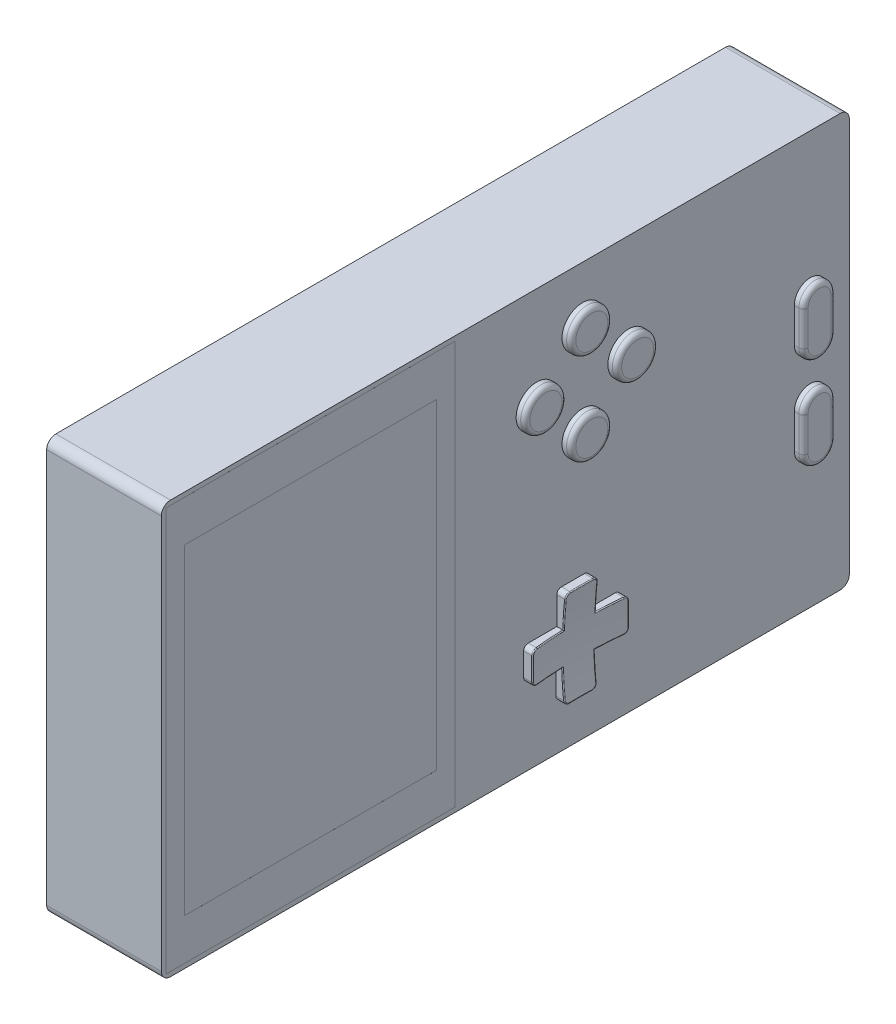
from build123d import *

# Parameters (mm, degrees)
SKETCH1_W           = 90
SKETCH1_H           = 150
SKETCH1_R           = 4.5
BOSS_EXTRUDE1_DEPTH = 25
BOSS_EXTRUDE2_DEPTH = 25.001
SKETCH1_5_W         = 70
SKETCH1_5_H         = 55
BOSS_EXTRUDE3_DEPTH = 25
SKETCH1_6_R         = 4.5
BOSS_EXTRUDE4_DEPTH = 27
BOSS_EXTRUDE5_DEPTH = 27
FILLET1_R           = 1
FILLET2_R           = 1
FILLET4_R           = 2
FILLET7_R           = 0.2


with BuildPart() as part:
    # Sketch1 → Boss-Extrude1 (new body)
    with BuildSketch(Plane.YZ):
        Rectangle(SKETCH1_W, SKETCH1_H)
        with BuildLine():
            ThreePointArc((-13.75, -70), (-17.25, -66.5), (-13.75, -63))
            Line((-13.75, -63), (-6.25, -63))
            ThreePointArc((-6.25, -63), (-2.75, -66.5), (-6.25, -70))
            Line((-6.25, -70), (-13.75, -70))
        make_face(mode=Mode.SUBTRACT)
        Polygon((-35, -11), (-28, -11), (-28, -4), (-21, -4), (-21, -11.236742726), (-14, -11.236742726), (-14, -18.236742726), (-21, -18.236742726), (-21, -25), (-28, -25), (-28, -18), (-35, -18), align=None, mode=Mode.SUBTRACT)
        with BuildLine():
            Line((6.25, -63), (13.75, -63))
            ThreePointArc((13.75, -63), (17.25, -66.5), (13.75, -70))
            Line((13.75, -70), (6.25, -70))
            ThreePointArc((6.25, -70), (2.75, -66.5), (6.25, -63))
        make_face(mode=Mode.SUBTRACT)
        with Locations((22.873097095, -26.851155952)):
            Circle(SKETCH1_R, mode=Mode.SUBTRACT)
        with Locations((32.873097095, -16.851155952)):
            Circle(SKETCH1_R, mode=Mode.SUBTRACT)
        Polygon((44, 11), (0, 11), (-44, 11), (-44, 74), (44, 74), align=None, mode=Mode.SUBTRACT)
    extrude(amount=BOSS_EXTRUDE1_DEPTH)

    # Sketch1<4> → Boss-Extrude2 (add)
    with BuildSketch(Plane.YZ):
        Polygon((-44, 11), (0, 11), (44, 11), (44, 74), (-44, 74), align=None)
        Polygon((-35, 15), (-35, 70), (35, 70), (35, 15), (0, 15), align=None, mode=Mode.SUBTRACT)
    extrude(amount=BOSS_EXTRUDE2_DEPTH)

    # Sketch1<6> → Boss-Extrude4 (add)
    with BuildSketch(Plane.YZ):
        Polygon((-28, -4), (-28, -11), (-35, -11), (-35, -18), (-28, -18), (-28, -25), (-21, -25), (-21, -18.236742726), (-14, -18.236742726), (-14, -11.236742726), (-21, -11.236742726), (-21, -4), align=None)
        with Locations((12.873097095, -16.851155952)):
            Circle(SKETCH1_6_R)
        with Locations((22.873097095, -6.851155952)):
            Circle(SKETCH1_6_R)
        with Locations((22.873097095, -26.851155952)):
            Circle(SKETCH1_6_R)
        with Locations((32.873097095, -16.851155952)):
            Circle(SKETCH1_6_R)
    extrude(amount=BOSS_EXTRUDE4_DEPTH)

    # Sketch1<7> → Boss-Extrude5 (add)
    with BuildSketch(Plane.YZ):
        with BuildLine():
            Line((-6.25, -63), (-13.75, -63))
            ThreePointArc((-13.75, -63), (-17.25, -66.5), (-13.75, -70))
            Line((-13.75, -70), (-6.25, -70))
            ThreePointArc((-6.25, -70), (-2.75, -66.5), (-6.25, -63))
        make_face()
        with BuildLine():
            ThreePointArc((13.75, -70), (17.25, -66.5), (13.75, -63))
            Line((13.75, -63), (6.25, -63))
            ThreePointArc((6.25, -63), (2.75, -66.5), (6.25, -70))
            Line((6.25, -70), (13.75, -70))
        make_face()
    extrude(amount=BOSS_EXTRUDE5_DEPTH)

    # Fillet1
    fillet1_edges = [part.edges().sort_by_distance(p)[0] for p in [
        (27, 18.373097095, -26.851155952),
        (26, -28, -4),
        (26, -35, -11),
        (26, -35, -18),
        (26, -28, -25),
        (26, -21, -25),
        (26, -21, -4),
        (26, -14, -11.236742726),
        (26, -14, -18.236742726),
        (27, 28.373097095, -16.851155952),
        (27, 8.373097095, -16.851155952),
        (27, 18.373097095, -6.851155952),
    ]]
    fillet(fillet1_edges, radius=FILLET1_R)

    # Fillet2
    fillet2_edges = [part.edges().sort_by_distance(p)[0] for p in [
        (27, 17.25, -66.5),
        (27, 10, -63),
        (27, 2.75, -66.5),
        (27, -17.25, -66.5),
        (27, -10, -63),
        (27, -2.75, -66.5),
        (27, 10, -70),
        (27, -10, -70),
    ]]
    fillet(fillet2_edges, radius=FILLET2_R)

    # Fillet4
    fillet4_edges = [part.edges().sort_by_distance(p)[0] for p in [
        (12.5, 45, 75),
        (12.5, -45, 75),
        (12.5, -45, -75),
        (12.5, 45, -75),
    ]]
    fillet(fillet4_edges, radius=FILLET4_R)

    # Sketch4 → Cut-Revolve5 (revolve, cut)
    with BuildSketch(Plane(origin=(0, -24.5, 0), x_dir=(-1, 0, 0), z_dir=(0, 1, 0))):
        with BuildLine():
            Line((-27, -3.5), (-27, -14.5))
            Line((-27, -14.5), (-26.510962298, -14.5))
            Line((-26.510962298, -14.5), (-26.35, -14.5))
            ThreePointArc((-26.35, -14.5), (-26.512641605, -8.990406095), (-27, -3.5))
        make_face()
    revolve(axis=Axis((26.25, -24.5, -14.5), (1, 0, 0)), mode=Mode.SUBTRACT)

    # Fillet7
    fillet7_edges = [part.edges().sort_by_distance(p)[0] for p in [
        (26.633844877, -17.996624049, -11.236742726),
        (26.956859924, -14.293763614, -11.52876663),
        (26.942369977, -14, -14.736828663),
        (26.973231747, -14.293739929, -17.944695195),
        (26.650771679, -21, -21.121543846),
        (26.964743442, -21.292035141, -24.70624766),
        (26.942067811, -24.5, -25),
        (26.964743441, -27.707964856, -24.706247652),
        (26.642442745, -31.003376575, -18),
        (26.964743442, -34.70624766, -17.707964859),
        (26.942067811, -35, -14.5),
        (26.964743441, -34.706247652, -11.292035144),
        (26.634264566, -21, -8.114789916),
        (26.964743442, -21.292035141, -4.29375234),
        (26.950487469, -25.75011341, -4),
        (26.964743441, -27.707964856, -4.293752348),
        (26.651643417, -17.996622757, -18.236742726),
        (26.642442745, -28, -21.003376575),
        (26.642442745, -31.003376575, -11),
        (26.642442745, -28, -7.996623425),
    ]]
    fillet(fillet7_edges, radius=FILLET7_R)


with BuildPart() as body_2:
    # Sketch1<5> → Boss-Extrude3 (new body)
    with BuildSketch(Plane.YZ):
        with Locations((0, 42.5)):
            Rectangle(SKETCH1_5_W, SKETCH1_5_H)
    extrude(amount=BOSS_EXTRUDE3_DEPTH)


solid = Compound([part.part, body_2.part])
